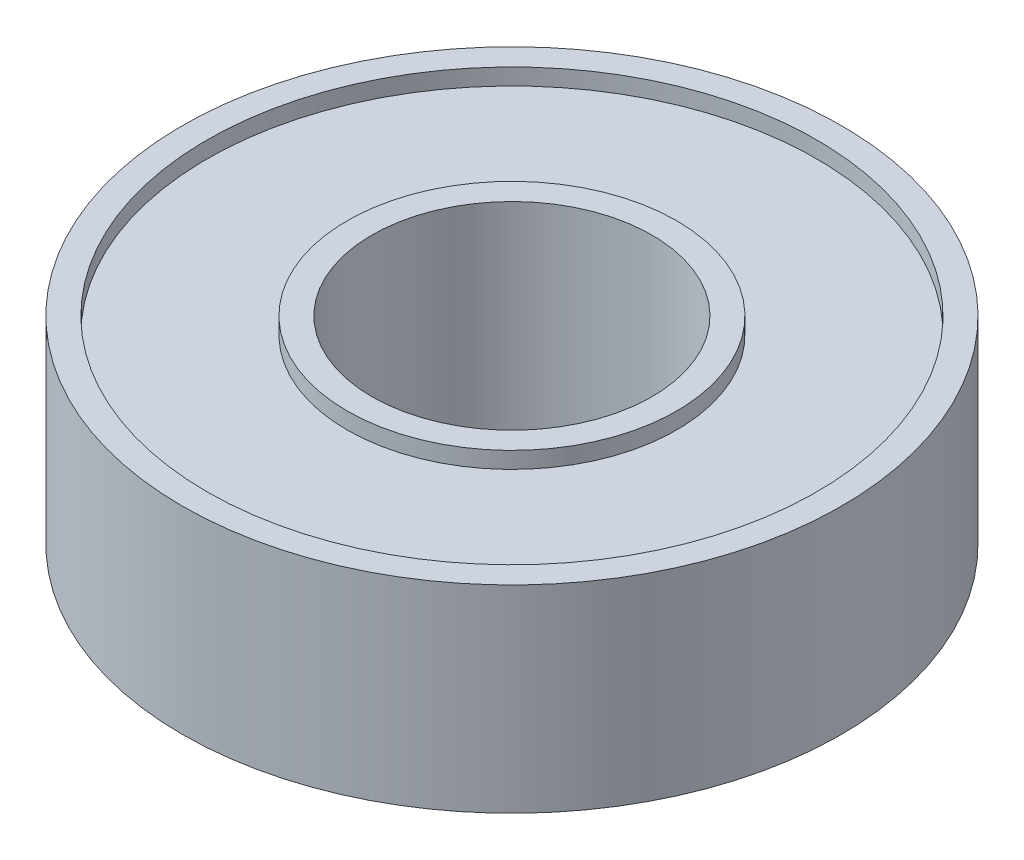
from build123d import *

# Parameters (mm, degrees)
SKETCH1_R           = 20
SKETCH1_R_2         = 8.5
BOSS_EXTRUDE1_DEPTH = 12
SKETCH2_R           = 18.5
SKETCH2_R_2         = 10
CUT_EXTRUDE1_DEPTH  = 1
CUT_EXTRUDE2_START  = -1
SKETCH3_R           = 18.5
SKETCH3_R_2         = 10
CUT_EXTRUDE2_DEPTH  = 1


with BuildPart() as part:
    # Sketch1 → Boss-Extrude1 (new body)
    with BuildSketch(Plane(origin=(0, 0, 0), x_dir=(1, 0, 0), z_dir=(0, 1, 0))):
        Circle(SKETCH1_R)
        Circle(SKETCH1_R_2, mode=Mode.SUBTRACT)
    extrude(amount=BOSS_EXTRUDE1_DEPTH)

    # Sketch2 → Cut-Extrude1 (cut)
    with BuildSketch(Plane(origin=(0, 12, 0), x_dir=(1, 0, 0), z_dir=(0, 1, 0))):
        Circle(SKETCH2_R)
        Circle(SKETCH2_R_2, mode=Mode.SUBTRACT)
    extrude(amount=-CUT_EXTRUDE1_DEPTH, mode=Mode.SUBTRACT)

    # Sketch3 → Cut-Extrude2 (cut)
    with BuildSketch(Plane.XZ.offset(CUT_EXTRUDE2_START)):
        Circle(SKETCH3_R)
        Circle(SKETCH3_R_2, mode=Mode.SUBTRACT)
    extrude(amount=CUT_EXTRUDE2_DEPTH, mode=Mode.SUBTRACT)


solid = part.part
